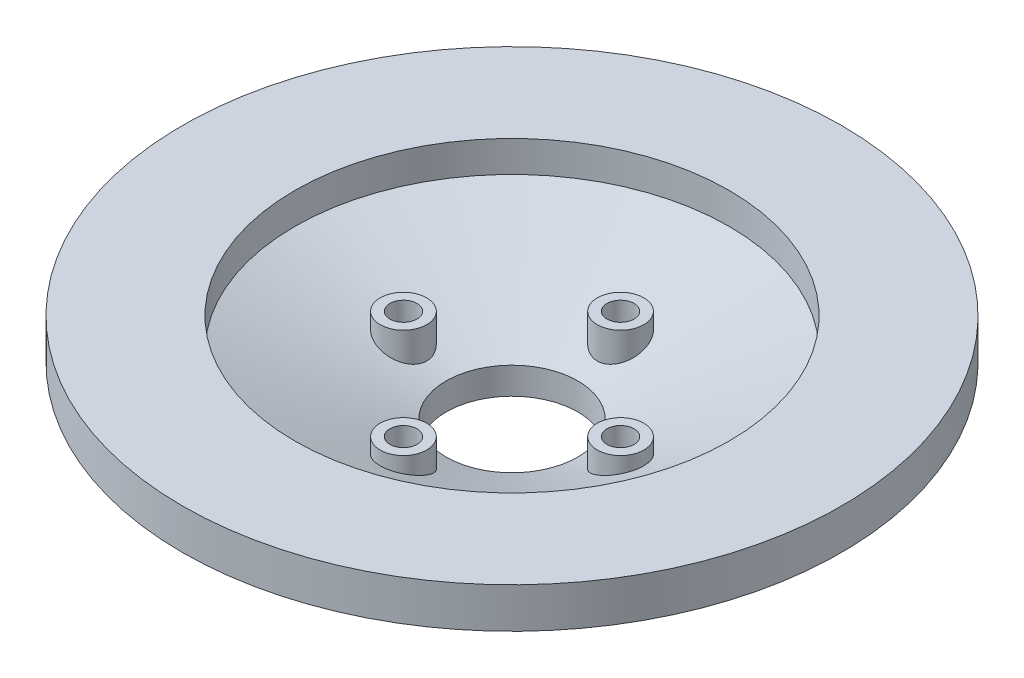
from build123d import *

# Parameters (mm, degrees)
SKETCH2_R           = 6
SKETCH2_R_2         = 3.5
BOSS_EXTRUDE1_DEPTH = 15
BOSS_EXTRUDE2_REACH = 125.426
SKETCH3_R           = 6
SKETCH4_R           = 3.5
CUT_EXTRUDE1_DEPTH  = 124.426091245


with BuildPart() as part:
    # Sketch1 → Revolve1 (revolve)
    with BuildSketch(Plane.XY):
        Polygon((17, 0), (22, 0), (22, 2), (67.7, 19.6), (85, 19.6), (85, 30), (56, 30), (56, 21.957917656), (17, 6.938224002), align=None)
    revolve(axis=Axis((0, 29.247184332, 0), (0, -1, 0)))

    # Sketch2 → Boss-Extrude1 (add)
    # profile 1 of 4: a face of its own
    with BuildSketch(Plane(origin=(0, 2, 0), x_dir=(-1, 0, 0), z_dir=(0, -1, 0))):
        with Locations((0, 28)):
            Circle(SKETCH2_R)
        with Locations((0, 28)):
            Circle(SKETCH2_R_2, mode=Mode.SUBTRACT)
    # profile 2 of 4: a face of its own
    with BuildSketch(Plane(origin=(0, 2, 0), x_dir=(-1, 0, 0), z_dir=(0, -1, 0))):
        with Locations((28, 0)):
            Circle(SKETCH2_R)
        with Locations((28, 0)):
            Circle(SKETCH2_R_2, mode=Mode.SUBTRACT)
    # profile 3 of 4: a face of its own
    with BuildSketch(Plane(origin=(0, 2, 0), x_dir=(-1, 0, 0), z_dir=(0, -1, 0))):
        with Locations((0, -28)):
            Circle(SKETCH2_R)
        with Locations((0, -28)):
            Circle(SKETCH2_R_2, mode=Mode.SUBTRACT)
    # profile 4 of 4: a face of its own
    with BuildSketch(Plane(origin=(0, 2, 0), x_dir=(-1, 0, 0), z_dir=(0, -1, 0))):
        with Locations((-28, 0)):
            Circle(SKETCH2_R)
        with Locations((-28, 0)):
            Circle(SKETCH2_R_2, mode=Mode.SUBTRACT)
    extrude(amount=-BOSS_EXTRUDE1_DEPTH)

    # Boss-Extrude2: up to this cone (the profile starts outside it)
    boss_extrude2_end = Plane(origin=(0, 2, 0), z_dir=(0, 1, 0)).offset(-8.472646702) * Cone(2.597e-06, 406.103306818, 156.398646702, align=(Align.CENTER, Align.CENTER, Align.MIN), mode=Mode.PRIVATE)
    # Sketch3 → Boss-Extrude2 (add, up to the surface)
    with BuildSketch(Plane(origin=(0, 2, 0), x_dir=(-1, 0, 0), z_dir=(0, -1, 0)), mode=Mode.PRIVATE) as boss_extrude2_sk1:
        with BuildLine():
            ThreePointArc((-22, 0), (-23.535857145, -4.008918629), (-27.357142857, -5.965461817))
            ThreePointArc((-27.357142857, -5.965461817), (-19.798989873, -19.798989873), (-5.965461817, -27.357142857))
            ThreePointArc((-5.965461817, -27.357142857), (0, -22), (5.965461817, -27.357142857))
            ThreePointArc((5.965461817, -27.357142857), (19.798989873, -19.798989873), (27.357142857, -5.965461817))
            ThreePointArc((27.357142857, -5.965461817), (22, 0), (27.357142857, 5.965461817))
            ThreePointArc((27.357142857, 5.965461817), (19.798989873, 19.798989873), (5.965461817, 27.357142857))
            ThreePointArc((5.965461817, 27.357142857), (0, 22), (-5.965461817, 27.357142857))
            ThreePointArc((-5.965461817, 27.357142857), (-19.798989873, 19.798989873), (-27.357142857, 5.965461817))
            ThreePointArc((-27.357142857, 5.965461817), (-23.535857145, 4.008918629), (-22, 0))
        make_face()
        Circle(SKETCH3_R, mode=Mode.SUBTRACT)
    boss_extrude2_tool1 = extrude(boss_extrude2_sk1.sketch, amount=-BOSS_EXTRUDE2_REACH, mode=Mode.PRIVATE) - boss_extrude2_end
    add(boss_extrude2_tool1.solids().sort_by_distance((22.960149, 2, -4.52592))[0])
    add(boss_extrude2_tool1.solids().sort_by_distance((22.960149, 2, -4.52592))[1])
    add(boss_extrude2_tool1.solids().sort_by_distance((22.960149, 2, -4.52592))[2])
    add(boss_extrude2_tool1.solids().sort_by_distance((22.960149, 2, -4.52592))[3])

    # Sketch4 → Cut-Extrude1 (cut, through all)
    with BuildSketch(Plane(origin=(0, 2, 0), x_dir=(-1, 0, 0), z_dir=(0, -1, 0))):
        with Locations((0, 28)):
            Circle(SKETCH4_R)
        with Locations((28, 0)):
            Circle(SKETCH4_R)
        with Locations((0, -28)):
            Circle(SKETCH4_R)
        with Locations((-28, 0)):
            Circle(SKETCH4_R)
    extrude(amount=-CUT_EXTRUDE1_DEPTH, mode=Mode.SUBTRACT)


solid = part.part
